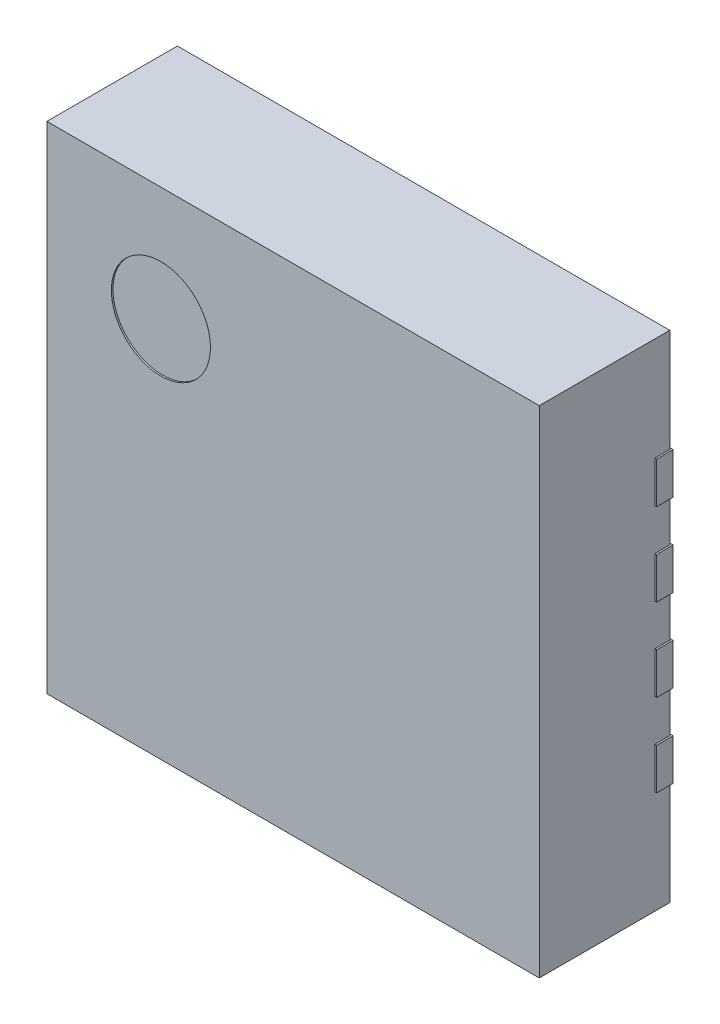
from build123d import *

# Parameters (mm, degrees)
BOSS_EXTRUDE4_DEPTH   = 0.1
SKETCH2_W             = 0.4
SKETCH2_H             = 0.25
BOSS_EXTRUDE4_2_DEPTH = 0.1
BOSS_EXTRUDE4_3_DEPTH = 0.1
BOSS_EXTRUDE4_4_DEPTH = 0.1
BOSS_EXTRUDE4_5_DEPTH = 0.1
BOSS_EXTRUDE4_6_DEPTH = 0.1
BOSS_EXTRUDE4_7_DEPTH = 0.1
BOSS_EXTRUDE4_8_DEPTH = 0.1
BOSS_EXTRUDE4_9_DEPTH = 0.1
SKETCH3_W             = 2.98
SKETCH3_H             = 3
BOSS_EXTRUDE2_DEPTH   = 0.79
SKETCH6_R             = 0.3
CUT_EXTRUDE2_DEPTH    = 0.01


with BuildPart() as part:
    # Sketch2 → Boss-Extrude4 (new body)
    with BuildSketch(Plane.XY):
        Polygon((-0.55, 1), (-0.8, 0.75), (-0.8, -1), (0.8, -1), (0.8, 1), align=None)
    extrude(amount=BOSS_EXTRUDE4_DEPTH)



with BuildPart() as body_2:
    # Sketch2 → Boss-Extrude4 2 (new body)
    with BuildSketch(Plane.XY):
        with Locations((-1.3, 0.75)):
            Rectangle(SKETCH2_W, SKETCH2_H)
    extrude(amount=BOSS_EXTRUDE4_2_DEPTH)


with BuildPart() as body_3:
    # Sketch2 → Boss-Extrude4 3 (new body)
    with BuildSketch(Plane.XY):
        with Locations((-1.3, 0.25)):
            Rectangle(SKETCH2_W, SKETCH2_H)
    extrude(amount=BOSS_EXTRUDE4_3_DEPTH)


with BuildPart() as body_4:
    # Sketch2 → Boss-Extrude4 4 (new body)
    with BuildSketch(Plane.XY):
        with Locations((-1.3, -0.25)):
            Rectangle(SKETCH2_W, SKETCH2_H)
    extrude(amount=BOSS_EXTRUDE4_4_DEPTH)


with BuildPart() as body_5:
    # Sketch2 → Boss-Extrude4 5 (new body)
    with BuildSketch(Plane.XY):
        with Locations((-1.3, -0.75)):
            Rectangle(SKETCH2_W, SKETCH2_H)
    extrude(amount=BOSS_EXTRUDE4_5_DEPTH)


with BuildPart() as body_6:
    # Sketch2 → Boss-Extrude4 6 (new body)
    with BuildSketch(Plane.XY):
        with Locations((1.3, 0.75)):
            Rectangle(SKETCH2_W, SKETCH2_H)
    extrude(amount=BOSS_EXTRUDE4_6_DEPTH)


with BuildPart() as body_7:
    # Sketch2 → Boss-Extrude4 7 (new body)
    with BuildSketch(Plane.XY):
        with Locations((1.3, 0.25)):
            Rectangle(SKETCH2_W, SKETCH2_H)
    extrude(amount=BOSS_EXTRUDE4_7_DEPTH)


with BuildPart() as body_8:
    # Sketch2 → Boss-Extrude4 8 (new body)
    with BuildSketch(Plane.XY):
        with Locations((1.3, -0.25)):
            Rectangle(SKETCH2_W, SKETCH2_H)
    extrude(amount=BOSS_EXTRUDE4_8_DEPTH)


with BuildPart() as body_9:
    # Sketch2 → Boss-Extrude4 9 (new body)
    with BuildSketch(Plane.XY):
        with Locations((1.3, -0.75)):
            Rectangle(SKETCH2_W, SKETCH2_H)
    extrude(amount=BOSS_EXTRUDE4_9_DEPTH)


with BuildPart() as part_1:
    add(part.part)

    add(body_2.part)  # Boss-Extrude2 merges body 2

    add(body_3.part)  # Boss-Extrude2 merges body 3

    add(body_4.part)  # Boss-Extrude2 merges body 4

    add(body_5.part)  # Boss-Extrude2 merges body 5

    add(body_6.part)  # Boss-Extrude2 merges body 6

    add(body_7.part)  # Boss-Extrude2 merges body 7

    add(body_8.part)  # Boss-Extrude2 merges body 8

    add(body_9.part)  # Boss-Extrude2 merges body 9
    # Sketch3 → Boss-Extrude2 (add)
    with BuildSketch(Plane.XY.offset(0.01)):
        Rectangle(SKETCH3_W, SKETCH3_H)
    extrude(amount=BOSS_EXTRUDE2_DEPTH)

    # Sketch6 → Cut-Extrude2 (cut)
    with BuildSketch(Plane.XY.offset(0.8)):
        with Locations((-0.8, 0.81)):
            Circle(SKETCH6_R)
    extrude(amount=-CUT_EXTRUDE2_DEPTH, mode=Mode.SUBTRACT)


solid = part_1.part
